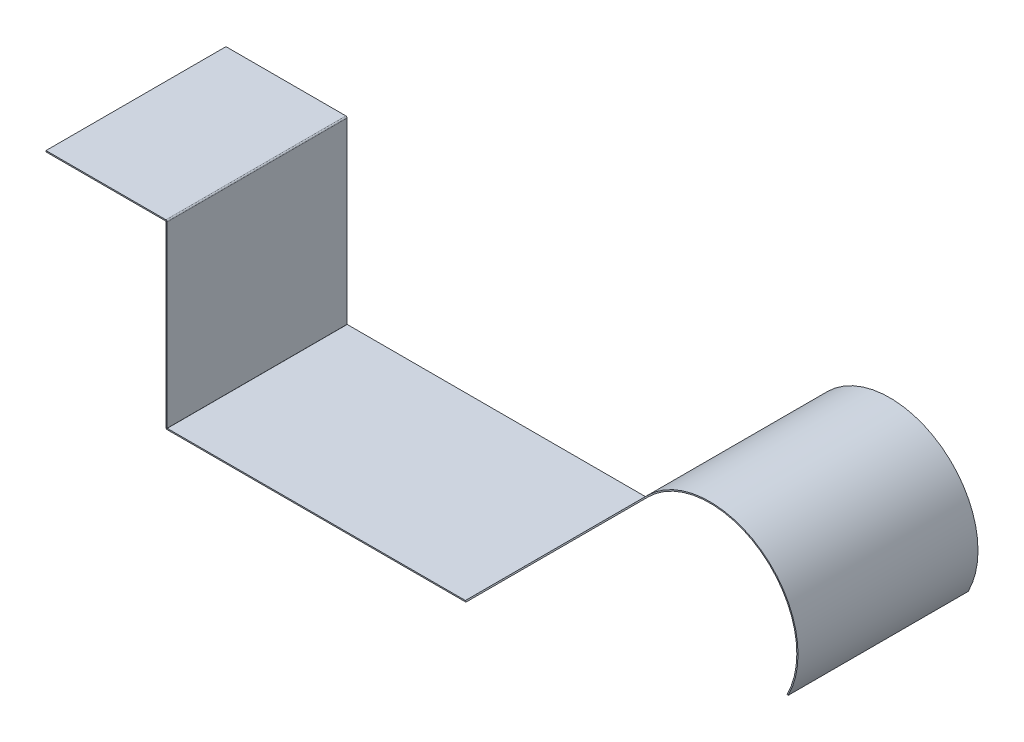
from build123d import *

# Parameters (mm, degrees)
SM_BASE_FLANGE_1_DEPTH = 300


# Sheet-metal steps are written as plain solids
with BuildPart() as part:
    # Sketch 1 → 基体-法兰1 (new body)
    with BuildSketch(Plane.XY):
        with BuildLine():
            Line((-200, 300), (-0.1, 300))
            ThreePointArc((-0.1, 300), (-0.029289322, 299.970710678), (0, 299.9))
            Line((0, 299.9), (0, 2.1))
            ThreePointArc((0, 2.1), (0.61507576, 0.61507576), (2.1, 0))
            Line((2.1, 0), (499.130151519, 0))
            ThreePointArc((499.130151519, 0), (499.933786727, 0.159852982), (500.61507576, 0.61507576))
            Line((500.61507576, 0.61507576), (804.05591591, 304.05591591))
            ThreePointArc((804.05591591, 304.05591591), (992.143758514, 318.593525064), (1035.4112588, 134.973531505))
            Line((1035.4112588, 134.973531505), (1037.188153416, 134.055574248))
            ThreePointArc((1037.188153416, 134.055574248), (993.323860022, 320.208257373), (802.641702348, 305.470129473))
            Line((802.641702348, 305.470129473), (499.200862197, 2.029289322))
            ThreePointArc((499.200862197, 2.029289322), (499.168419862, 2.007612047), (499.130151519, 2))
            Line((499.130151519, 2), (2.1, 2))
            ThreePointArc((2.1, 2), (2.029289322, 2.029289322), (2, 2.1))
            Line((2, 2.1), (2, 299.9))
            ThreePointArc((2, 299.9), (1.38492424, 301.384924241), (-0.100000001, 302))
            Line((-0.1, 302), (-200, 302))
            Line((-200, 302), (-200, 300))
        make_face()
    extrude(amount=-SM_BASE_FLANGE_1_DEPTH)


solid = part.part
